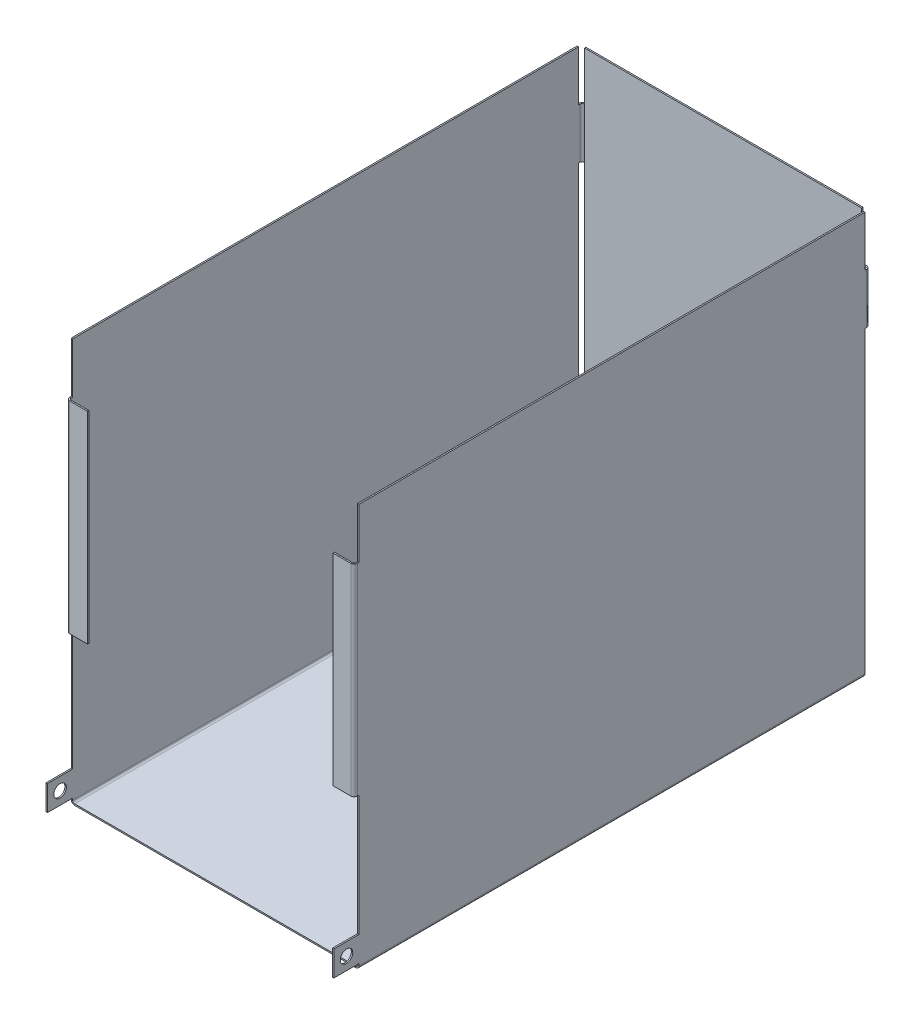
from build123d import *

# Parameters (mm, degrees)
SKETCH2_W           = 139.7
SKETCH2_H           = 254
BASE_FLANGE1_DEPTH  = 0.7
EDGE_FLANGE4_DEPTH  = 139.7
EDGE_FLANGE5_DEPTH  = 255
EDGE_FLANGE6_DEPTH  = 255
EDGE_FLANGE7_DEPTH  = 25.4
EDGE_FLANGE9_DEPTH  = 25.4
EDGE_FLANGE10_DEPTH = 101.6
EDGE_FLANGE11_DEPTH = 101.6
SKETCH76_W          = 12.7
SKETCH76_H          = 12.7
TAB1_DEPTH          = 0.7
SKETCH79_W          = 12.7
SKETCH79_H          = 12.7
TAB2_DEPTH          = 0.7
SKETCH86_R          = 3.15
CUT_EXTRUDE3_DEPTH  = 286.615738362


# Sheet-metal steps are written as plain solids
with BuildPart() as part:
    # Sketch2 → Base-Flange1 (new body)
    with BuildSketch(Plane(origin=(0, 0, 0), x_dir=(1, 0, 0), z_dir=(0, 1, 0))):
        Rectangle(SKETCH2_W, SKETCH2_H)
    extrude(amount=-BASE_FLANGE1_DEPTH)

    # Edge-Flange4 section (across the edge) → Edge-Flange4 (add)
    with BuildSketch(Plane(origin=(69.85, 0, -129), x_dir=(0, 0, 1), z_dir=(-1, 0, 0))):
        with BuildLine():
            Line((-0.7, 1), (-0.7, 202.5))
            Line((-0.7, 202.5), (0, 202.5))
            Line((0, 202.5), (0, 1))
            ThreePointArc((0, 1), (0.292893219, 0.292893219), (1, 0))
            Line((1, 0), (2, 0))
            Line((2, 0), (2, -0.7))
            Line((2, -0.7), (1, -0.7))
            ThreePointArc((1, -0.7), (-0.202081528, -0.202081528), (-0.7, 1))
        make_face()
    extrude(amount=EDGE_FLANGE4_DEPTH)

    # Edge-Flange5 section (across the edge) → Edge-Flange5 (add)
    with BuildSketch(Plane(origin=(-71.85, 0, -128), x_dir=(1, 0, 0), z_dir=(0, 0, 1))):
        with BuildLine():
            Line((-0.7, 1), (-0.7, 202.5))
            Line((-0.7, 202.5), (0, 202.5))
            Line((0, 202.5), (0, 1))
            ThreePointArc((0, 1), (0.292893219, 0.292893219), (1, 0))
            Line((1, 0), (2, 0))
            Line((2, 0), (2, -0.7))
            Line((2, -0.7), (1, -0.7))
            ThreePointArc((1, -0.7), (-0.202081528, -0.202081528), (-0.7, 1))
        make_face()
    extrude(amount=EDGE_FLANGE5_DEPTH)

    # Edge-Flange6 section (across the edge) → Edge-Flange6 (add)
    with BuildSketch(Plane(origin=(71.85, 0, 127), x_dir=(-1, 0, 0), z_dir=(0, 0, -1))):
        with BuildLine():
            Line((-0.7, 1), (-0.7, 202.5))
            Line((-0.7, 202.5), (0, 202.5))
            Line((0, 202.5), (0, 1))
            ThreePointArc((0, 1), (0.292893219, 0.292893219), (1, 0))
            Line((1, 0), (2, 0))
            Line((2, 0), (2, -0.7))
            Line((2, -0.7), (1, -0.7))
            ThreePointArc((1, -0.7), (-0.202081528, -0.202081528), (-0.7, 1))
        make_face()
    extrude(amount=EDGE_FLANGE6_DEPTH)

    # Edge-Flange7 section (across the edge) → Edge-Flange7 (add)
    with BuildSketch(Plane(origin=(-71.85, 151.7, -129.8), x_dir=(0, 0, 1), z_dir=(0, 1, 0))):
        with BuildLine():
            Line((-0.7, 1), (-0.7, 24.7))
            Line((-0.7, 24.7), (0, 24.7))
            Line((0, 24.7), (0, 1))
            ThreePointArc((0, 1), (0.292893219, 0.292893219), (1, 0))
            Line((1, 0), (1.8, 0))
            Line((1.8, 0), (1.8, -0.7))
            Line((1.8, -0.7), (1, -0.7))
            ThreePointArc((1, -0.7), (-0.202081528, -0.202081528), (-0.7, 1))
        make_face()
    extrude(amount=EDGE_FLANGE7_DEPTH)

    # Edge-Flange9 section (across the edge) → Edge-Flange9 (add)
    with BuildSketch(Plane(origin=(71.85, 177.1, -129.8), x_dir=(0, 0, 1), z_dir=(0, -1, 0))):
        with BuildLine():
            Line((-0.7, 1), (-0.7, 24.7))
            Line((-0.7, 24.7), (0, 24.7))
            Line((0, 24.7), (0, 1))
            ThreePointArc((0, 1), (0.292893219, 0.292893219), (1, 0))
            Line((1, 0), (1.8, 0))
            Line((1.8, 0), (1.8, -0.7))
            Line((1.8, -0.7), (1, -0.7))
            ThreePointArc((1, -0.7), (-0.202081528, -0.202081528), (-0.7, 1))
        make_face()
    extrude(amount=EDGE_FLANGE9_DEPTH)

    # Edge-Flange10 section (across the edge) → Edge-Flange10 (add)
    with BuildSketch(Plane(origin=(71.85, 75.5, 128.8), x_dir=(0, 0, -1), z_dir=(0, 1, 0))):
        with BuildLine():
            Line((-0.7, 1), (-0.7, 10))
            Line((-0.7, 10), (0, 10))
            Line((0, 10), (0, 1))
            ThreePointArc((0, 1), (0.292893219, 0.292893219), (1, 0))
            Line((1, 0), (1.8, 0))
            Line((1.8, 0), (1.8, -0.7))
            Line((1.8, -0.7), (1, -0.7))
            ThreePointArc((1, -0.7), (-0.202081528, -0.202081528), (-0.7, 1))
        make_face()
    extrude(amount=EDGE_FLANGE10_DEPTH)

    # Edge-Flange11 section (across the edge) → Edge-Flange11 (add)
    with BuildSketch(Plane(origin=(-71.85, 177.1, 128.8), x_dir=(0, 0, -1), z_dir=(0, -1, 0))):
        with BuildLine():
            Line((-0.7, 1), (-0.7, 10))
            Line((-0.7, 10), (0, 10))
            Line((0, 10), (0, 1))
            ThreePointArc((0, 1), (0.292893219, 0.292893219), (1, 0))
            Line((1, 0), (1.8, 0))
            Line((1.8, 0), (1.8, -0.7))
            Line((1.8, -0.7), (1, -0.7))
            ThreePointArc((1, -0.7), (-0.202081528, -0.202081528), (-0.7, 1))
        make_face()
    extrude(amount=EDGE_FLANGE11_DEPTH)

    # Sketch76 → Tab1 (add)
    with BuildSketch(Plane.ZY.offset(72.55)):
        with Locations((133.35, 8.35)):
            Rectangle(SKETCH76_W, SKETCH76_H)
    extrude(amount=-TAB1_DEPTH)

    # Sketch79 → Tab2 (add)
    with BuildSketch(Plane(origin=(72.55, 0, 0), x_dir=(0, 0, -1), z_dir=(1, 0, 0))):
        with Locations((-133.35, 8.35)):
            Rectangle(SKETCH79_W, SKETCH79_H)
    extrude(amount=-TAB2_DEPTH)

    # Sketch86 → Cut-Extrude3 (cut, through all)
    with BuildSketch(Plane(origin=(72.55, 0, 0), x_dir=(0, 0, -1), z_dir=(1, 0, 0))):
        with Locations(Location((-133.35, 8.35, 0), (0, 0, 90))):
            Circle(SKETCH86_R)
    extrude(amount=-CUT_EXTRUDE3_DEPTH, mode=Mode.SUBTRACT)


solid = part.part
